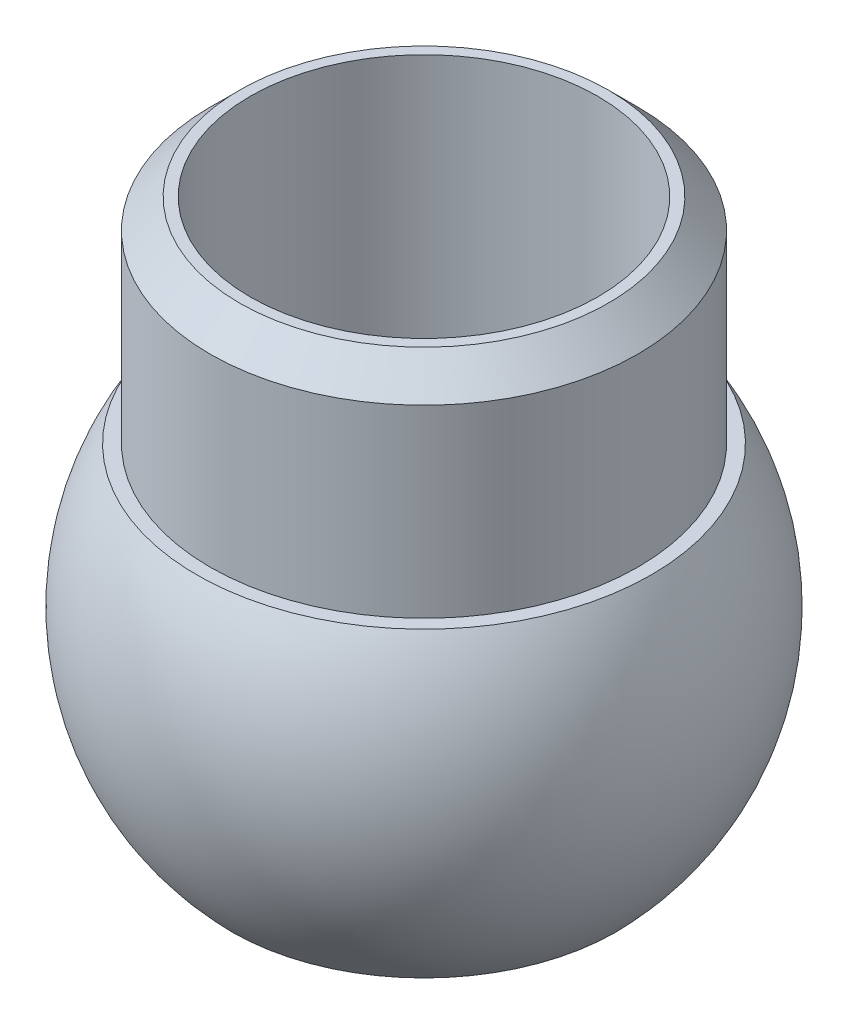
from build123d import *


# Read off the part's stored shape, not the designer's step: M16x2.0 Machine Threads Stud1
with BuildPart() as part:
    # Sketch1 → Revolve1 (revolve)
    with BuildSketch(Plane.XY):
        with BuildLine():
            Line((-8.5, 13.267826876), (-6.5, 13.267826876))
            Line((-6.5, 13.267826876), (-6.5, 0))
            ThreePointArc((-6.5, 0), (-6.116831152, -2.198721596), (-5.01249949, -4.138218078))
            Line((-5.01249949, -4.138218078), (-7.180291398, -6.960130418))
            ThreePointArc((-7.180291398, -6.960130418), (-9.942264304, -1.073024006), (-8.5, 5.267826876))
            Line((-8.5, 5.267826876), (-8.5, 13.267826876))
        make_face()
    revolve(axis=Axis((0, 28.261953017, 0), (0, -1, 0)))

    # M16x2.0 Machine Threads Stud1 outline → M16x2.0 Machine Threads Stud1 (revolve, cut)
    with BuildSketch(Plane.XY):
        Polygon((8.5, 13.267826876), (6.8985, 13.267826876), (8, 12.166326876), (8, 5.267826876), (8.5, 5.267826876), align=None)
    revolve(axis=Axis((0, 0, 0), (0, 1, 0)), mode=Mode.SUBTRACT)


solid = part.part
